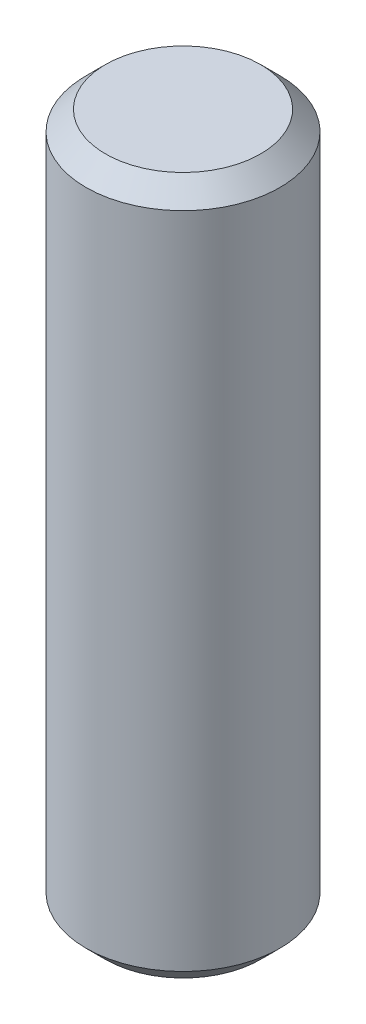
from build123d import *

# Parameters (mm, degrees)
CHAMFER_1_SIZE = 1


with BuildPart() as part:
    # 草图1 → 旋转1 (revolve)
    with BuildSketch(Plane.XY):
        Polygon((0, 23), (5, 23), (5, 5), (5, 0), (5, -13), (0, -13), align=None)
    revolve(axis=Axis((0, 23.073688006, 0), (0, -1, 0)))

    # 倒角1
    chamfer_1_edges = [part.edges().sort_by_distance(p)[0] for p in [
        (-5, -13, 0),
        (-5, 23, 0),
    ]]
    chamfer(chamfer_1_edges, length=CHAMFER_1_SIZE)


solid = part.part
